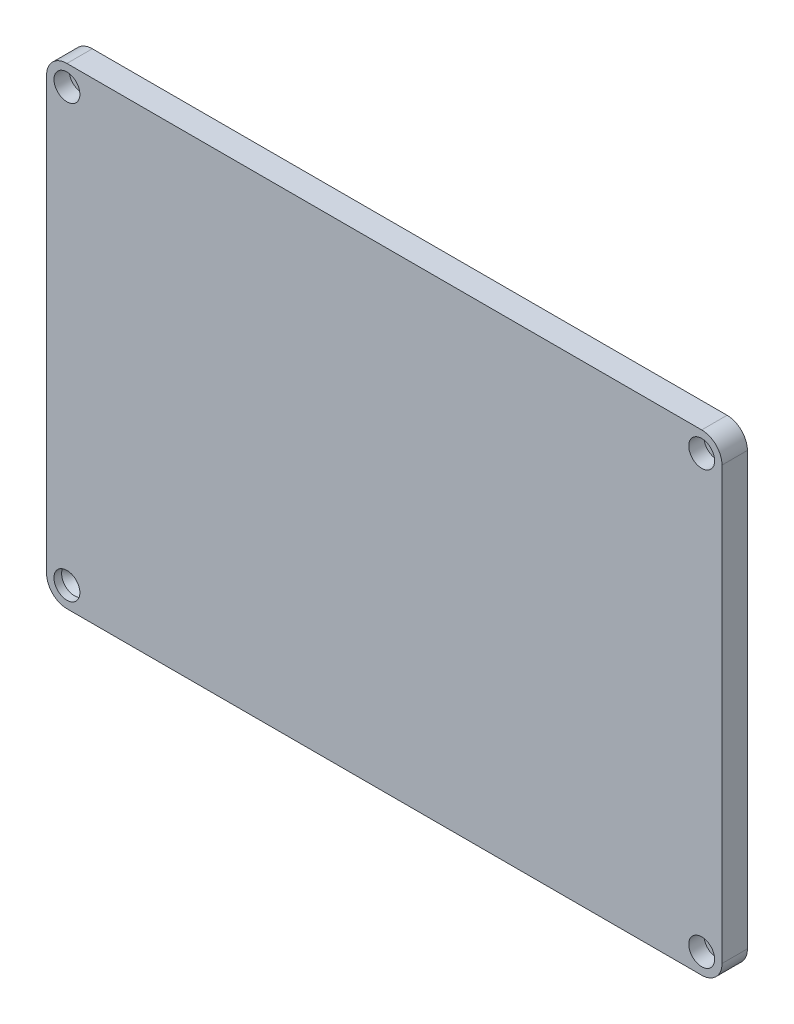
from build123d import *

# Parameters (mm, degrees)
SKETCH2_R           = 1.25
BOSS_EXTRUDE1_DEPTH = 2
SKETCH3_R           = 2.55
BOSS_EXTRUDE2_DEPTH = 3
BOSS_EXTRUDE3_START = 3
BOSS_EXTRUDE3_DEPTH = 3
CHAMFER1_SIZE       = 0.5
CHAMFER2_SIZE       = 1.5


with BuildPart() as part:
    # Sketch2 → Boss-Extrude1 (new body)
    with BuildSketch(Plane.XY):
        with BuildLine():
            Line((66.5, -42.5), (66.5, 42.5))
            ThreePointArc((66.5, 42.5), (65.328427125, 45.328427125), (62.5, 46.5))
            Line((62.5, 46.5), (-62.5, 46.5))
            ThreePointArc((-62.5, 46.5), (-65.328427125, 45.328427125), (-66.5, 42.5))
            Line((-66.5, 42.5), (-66.5, -42.5))
            ThreePointArc((-66.5, -42.5), (-65.328427125, -45.328427125), (-62.5, -46.5))
            Line((-62.5, -46.5), (62.5, -46.5))
            ThreePointArc((62.5, -46.5), (65.328427125, -45.328427125), (66.5, -42.5))
        make_face()
        with Locations((-62.5, 42.5)):
            Circle(SKETCH2_R, mode=Mode.SUBTRACT)
        with Locations((62.5, 42.5)):
            Circle(SKETCH2_R, mode=Mode.SUBTRACT)
        with Locations((-62.5, -42.5)):
            Circle(SKETCH2_R, mode=Mode.SUBTRACT)
        with Locations((62.5, -42.5)):
            Circle(SKETCH2_R, mode=Mode.SUBTRACT)
        with BuildLine():
            Line((-62.5, -36.843145751), (-62.5, 36.843145751))
            ThreePointArc((-62.5, 36.843145751), (-62.132993162, 37.997846289), (-61.166666667, 38.728763834))
            ThreePointArc((-61.166666667, 38.728763834), (-59.671572875, 39.671572875), (-58.728763834, 41.166666667))
            ThreePointArc((-58.728763834, 41.166666667), (-57.997846289, 42.132993162), (-56.843145751, 42.5))
            Line((-56.843145751, 42.5), (56.843145751, 42.5))
            ThreePointArc((56.843145751, 42.5), (57.997846289, 42.132993162), (58.728763834, 41.166666667))
            ThreePointArc((58.728763834, 41.166666667), (59.671572875, 39.671572875), (61.166666667, 38.728763834))
            ThreePointArc((61.166666667, 38.728763834), (62.132993162, 37.997846289), (62.5, 36.843145751))
            Line((62.5, 36.843145751), (62.5, -36.843145751))
            ThreePointArc((62.5, -36.843145751), (62.132993162, -37.997846289), (61.166666667, -38.728763834))
            ThreePointArc((61.166666667, -38.728763834), (59.671572875, -39.671572875), (58.728763834, -41.166666667))
            ThreePointArc((58.728763834, -41.166666667), (57.997846289, -42.132993162), (56.843145751, -42.5))
            Line((56.843145751, -42.5), (-56.843145751, -42.5))
            ThreePointArc((-56.843145751, -42.5), (-57.997846289, -42.132993162), (-58.728763834, -41.166666667))
            ThreePointArc((-58.728763834, -41.166666667), (-59.671572875, -39.671572875), (-61.166666667, -38.728763834))
            ThreePointArc((-61.166666667, -38.728763834), (-62.132993162, -37.997846289), (-62.5, -36.843145751))
        make_face(mode=Mode.SUBTRACT)
    extrude(amount=BOSS_EXTRUDE1_DEPTH)

    # Sketch3 → Boss-Extrude2 (add)
    with BuildSketch(Plane.XY.offset(2)):
        with BuildLine():
            Line((66.5, -42.5), (66.5, 42.5))
            ThreePointArc((66.5, 42.5), (65.328427125, 45.328427125), (62.5, 46.5))
            Line((62.5, 46.5), (-62.5, 46.5))
            ThreePointArc((-62.5, 46.5), (-65.328427125, 45.328427125), (-66.5, 42.5))
            Line((-66.5, 42.5), (-66.5, -42.5))
            ThreePointArc((-66.5, -42.5), (-65.328427125, -45.328427125), (-62.5, -46.5))
            Line((-62.5, -46.5), (62.5, -46.5))
            ThreePointArc((62.5, -46.5), (65.328427125, -45.328427125), (66.5, -42.5))
        make_face()
        with Locations((-62.5, 42.5)):
            Circle(SKETCH3_R, mode=Mode.SUBTRACT)
        with Locations((62.5, 42.5)):
            Circle(SKETCH3_R, mode=Mode.SUBTRACT)
        with Locations((62.5, -42.5)):
            Circle(SKETCH3_R, mode=Mode.SUBTRACT)
        with Locations((-62.5, -42.5)):
            Circle(SKETCH3_R, mode=Mode.SUBTRACT)
    extrude(amount=BOSS_EXTRUDE2_DEPTH)

    # Sketch4 → Boss-Extrude3 (add)
    with BuildSketch(Plane(origin=(0, 0, 2), x_dir=(-1, 0, 0), z_dir=(0, 0, -1)).offset(BOSS_EXTRUDE3_START)):
        with BuildLine():
            Line((62.5, -36.843145751), (62.5, 36.843145751))
            ThreePointArc((62.5, 36.843145751), (62.132993162, 37.997846289), (61.166666667, 38.728763834))
            ThreePointArc((61.166666667, 38.728763834), (59.671572875, 39.671572875), (58.728763834, 41.166666667))
            ThreePointArc((58.728763834, 41.166666667), (57.997846289, 42.132993162), (56.843145751, 42.5))
            Line((56.843145751, 42.5), (-56.843145751, 42.5))
            ThreePointArc((-56.843145751, 42.5), (-57.997846289, 42.132993162), (-58.728763834, 41.166666667))
            ThreePointArc((-58.728763834, 41.166666667), (-59.671572875, 39.671572875), (-61.166666667, 38.728763834))
            ThreePointArc((-61.166666667, 38.728763834), (-62.132993162, 37.997846289), (-62.5, 36.843145751))
            Line((-62.5, 36.843145751), (-62.5, -36.843145751))
            ThreePointArc((-62.5, -36.843145751), (-62.132993162, -37.997846289), (-61.166666667, -38.728763834))
            ThreePointArc((-61.166666667, -38.728763834), (-59.671572875, -39.671572875), (-58.728763834, -41.166666667))
            ThreePointArc((-58.728763834, -41.166666667), (-57.997846289, -42.132993162), (-56.843145751, -42.5))
            Line((-56.843145751, -42.5), (56.843145751, -42.5))
            ThreePointArc((56.843145751, -42.5), (57.997846289, -42.132993162), (58.728763834, -41.166666667))
            ThreePointArc((58.728763834, -41.166666667), (59.671572875, -39.671572875), (61.166666667, -38.728763834))
            ThreePointArc((61.166666667, -38.728763834), (62.132993162, -37.997846289), (62.5, -36.843145751))
        make_face()
    extrude(amount=-BOSS_EXTRUDE3_DEPTH)

    # Chamfer1
    chamfer1_edges = [part.edges().sort_by_distance(p)[0] for p in [
        (-59.671572875, -39.671572875, -1),
        (-62.132993162, -37.997846289, -1),
        (-62.5, 0, -1),
        (-62.132993162, 37.997846289, -1),
        (-59.671572875, 39.671572875, -1),
        (-57.997846289, 42.132993162, -1),
        (0, 42.5, -1),
        (57.997846289, 42.132993162, -1),
        (59.671572875, 39.671572875, -1),
        (62.132993162, 37.997846289, -1),
        (62.5, 0, -1),
        (62.132993162, -37.997846289, -1),
        (59.671572875, -39.671572875, -1),
        (57.997846289, -42.132993162, -1),
        (0, -42.5, -1),
        (-57.997846289, -42.132993162, -1),
    ]]
    chamfer(chamfer1_edges, length=CHAMFER1_SIZE)

    # Chamfer2
    # the kernel refuses this chamfer: 1.5 mm, written as the material it adds along each edge
    with BuildSketch(Plane(origin=(-62.5, -42.5, 2), x_dir=(1, 0, 0), z_dir=(0, -1, 0))) as chamfer2_piece_1_section:
        Polygon((2.55 - CHAMFER2_SIZE, 0), (2.55, CHAMFER2_SIZE), (2.55, 0), align=None)
    chamfer2_piece_1 = revolve(axis=Axis((-62.5, -42.5, 2), (0, 0, 1)), mode=Mode.PRIVATE)
    chamfer2_piece_1 = chamfer2_piece_1 - Plane(origin=(-62.5, -42.5, 2.85349357), x_dir=(1, 0, 0), z_dir=(0, 0, -1)) * Cylinder(1.25, 11, mode=Mode.PRIVATE)
    add(chamfer2_piece_1)


solid = part.part
